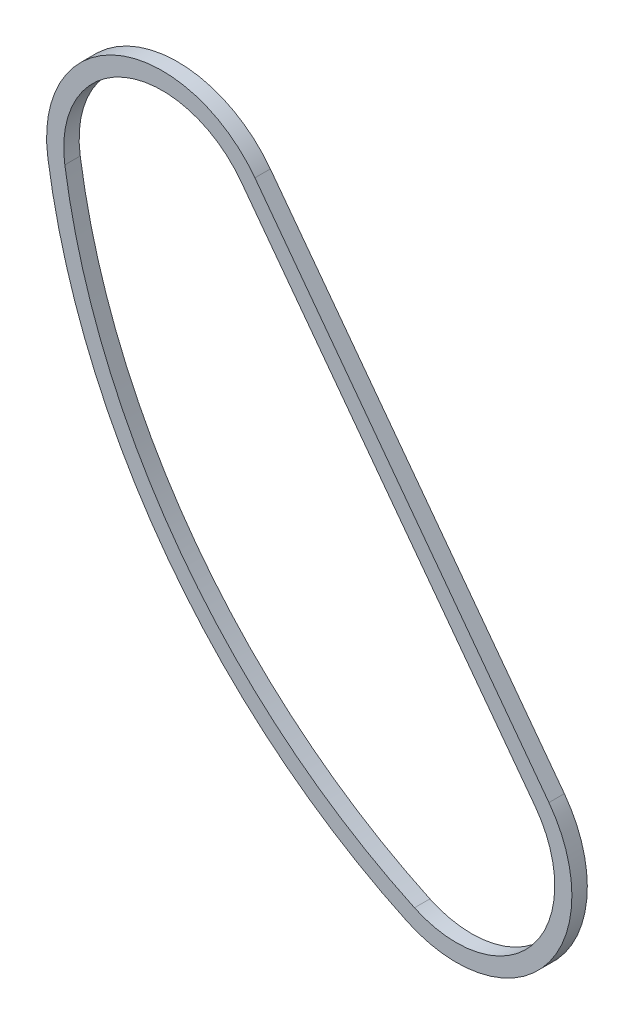
from build123d import *

# Parameters (mm, degrees)
BOSS_EXTRUDE1_DEPTH = 4.5


with BuildPart() as part:
    # Sketch1 → Boss-Extrude1 (new body)
    with BuildSketch(Plane.XY):
        with BuildLine():
            Line((112.854654883, -94.797302062), (27.048554883, 20.185097938))
            ThreePointArc((27.048554883, 20.185097938), (-12.995119589, 31.147862958), (-33.374023418, -5.023650154))
            ThreePointArc((-33.374023418, -5.023650154), (1.42859918, -88.441683505), (71.491698359, -145.546437784))
            ThreePointArc((71.491698359, -145.546437784), (111.967299491, -136.305020411), (112.854654883, -94.797302062))
        make_face()
        with BuildLine():
            Line((108.847461567, -97.787686942), (23.041361567, 17.194713058))
            ThreePointArc((23.041361567, 17.194713058), (-11.069916687, 26.533364742), (-28.429723653, -4.279405686))
            ThreePointArc((-28.429723653, -4.279405686), (5.435792496, -85.451298625), (73.612350454, -141.018432186))
            ThreePointArc((73.612350454, -141.018432186), (108.091566233, -133.146113683), (108.847461567, -97.787686942))
        make_face(mode=Mode.SUBTRACT)
    extrude(amount=BOSS_EXTRUDE1_DEPTH)


solid = part.part
